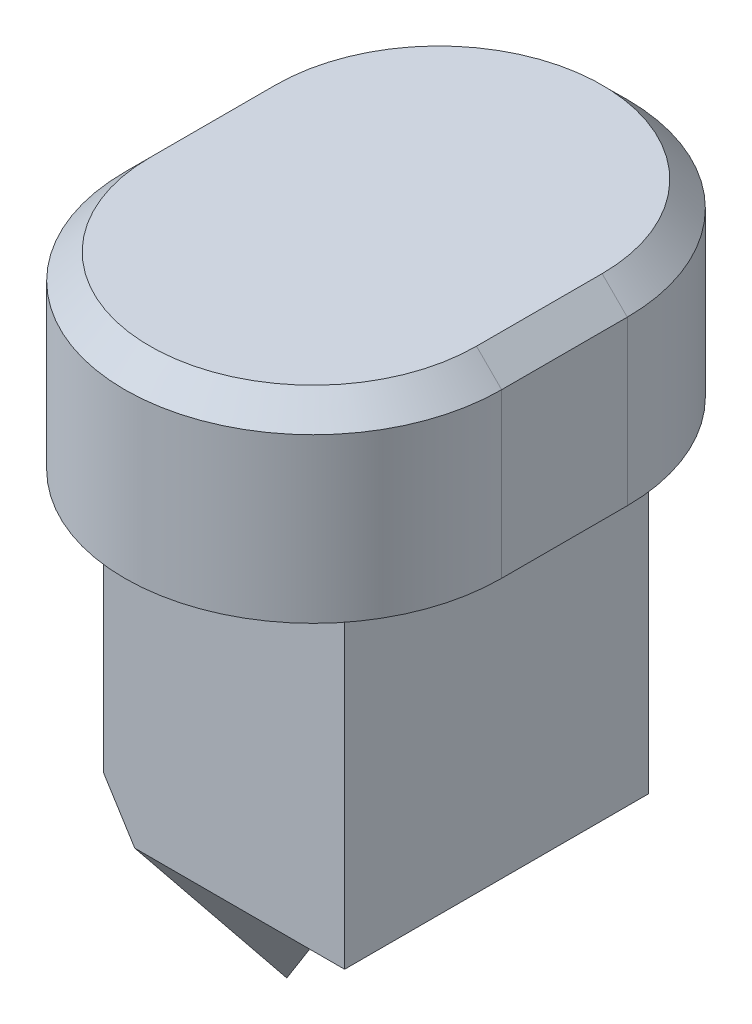
from build123d import *

# Parameters (mm, degrees)
SKETCH1_W               = 19.2
SKETCH1_H               = 24.2
BOSS_EXTRUDE1_DEPTH     = 26.1
BOSS_EXTRUDE2_DEPTH     = 15
BOSS_EXTRUDE3_DEPTH     = 5
BOSS_EXTRUDE4_DEPTH     = 1.5
CHAMFER1_SIZE           = 2.5
FILLET1_R               = 3
SKETCH9_W               = 19.8
SKETCH9_H               = 24.8
SKETCH9_W_2             = 19.2
SKETCH9_H_2             = 24.2
CUT_EXTRUDE_THIN1_DEPTH = 10
SKETCH10_W              = 24.8
SKETCH10_H              = 0.3
CUT_EXTRUDE1_DEPTH      = 19.2
SKETCH12_W              = 19.8
SKETCH12_H              = 24.8
CUT_EXTRUDE3_DEPTH      = 0.3
CHAMFER2_SIZE           = 0.75
CHAMFER3_SIZE           = 0.75
SKETCH14_R              = 2.2
SKETCH14_R_2            = 1.25
CUT_EXTRUDE4_DEPTH      = 4
CHAMFER6_SIZE           = 2
SKETCH16_R              = 1.25
CUT_EXTRUDE6_DEPTH      = 1


with BuildPart() as part:
    # Sketch1 → Boss-Extrude1 (new body)
    with BuildSketch(Plane(origin=(0, 0, 0), x_dir=(1, 0, 0), z_dir=(0, 1, 0))):
        Rectangle(SKETCH1_W, SKETCH1_H)
    extrude(amount=BOSS_EXTRUDE1_DEPTH)

    # Sketch2 → Boss-Extrude2 (add)
    with BuildSketch(Plane(origin=(0, 26.1, 0), x_dir=(1, 0, 0), z_dir=(0, 1, 0))):
        with BuildLine():
            Line((15, 5), (15, -5))
            ThreePointArc((15, -5), (0, -20), (-15, -5))
            Line((-15, -5), (-15, 5))
            ThreePointArc((-15, 5), (0, 20), (15, 5))
        make_face()
    extrude(amount=BOSS_EXTRUDE2_DEPTH)

    # Sketch4 → Boss-Extrude3 (add)
    with BuildSketch(Plane.ZY.offset(9.6)):
        Polygon((-12.1, 0), (0, -15), (12.1, 0), align=None)
    extrude(amount=-BOSS_EXTRUDE3_DEPTH)

    # Sketch6 → Boss-Extrude4 (add, symmetric)
    with BuildSketch(Plane.XY):
        Polygon((-4.6, -5), (9.6, 0), (-4.6, 0), align=None)
    extrude(amount=BOSS_EXTRUDE4_DEPTH, both=True)

    # Chamfer1
    chamfer1_edges = [part.edges().sort_by_distance(p)[0] for p in [
        (-9.6, -7.5, -6.05),
        (-4.6, -7.5, -6.05),
        (-9.6, -7.5, 6.05),
        (-4.6, -7.5, 6.05),
    ]]
    chamfer(chamfer1_edges, length=CHAMFER1_SIZE - 0.0001)  # a hair under: the kernel refuses the full size

    # Fillet1
    fillet1_edges = [part.edges().sort_by_distance(p)[0] for p in [
        (-4.6, 0, -5.194064205),
        (-4.6, 0, 5.194064205),
    ]]
    fillet(fillet1_edges, radius=FILLET1_R)

    # Sketch9 → Cut-Extrude-Thin1 (cut)
    with BuildSketch(Plane.XZ.offset(-26.1)):
        Rectangle(SKETCH9_W, SKETCH9_H)
        Rectangle(SKETCH9_W_2, SKETCH9_H_2, mode=Mode.SUBTRACT)
    extrude(amount=-CUT_EXTRUDE_THIN1_DEPTH, mode=Mode.SUBTRACT)

    # Sketch10 → Cut-Extrude1 (cut)
    with BuildSketch(Plane.ZY.offset(9.6)):
        with Locations((0, 36.25)):
            Rectangle(SKETCH10_W, SKETCH10_H)
    extrude(amount=-CUT_EXTRUDE1_DEPTH, mode=Mode.SUBTRACT)


with BuildPart() as cut_extrude1_piece_1:
    # of the separate pieces the step leaves, piece 1, a body of its own (cut_extrude1_pieces)
    add(part.part.solids().sort_by_distance((-1.6, 0, 1.5))[0])

    # Chamfer3
    chamfer3_edges = [cut_extrude1_piece_1.edges().sort_by_distance(p)[0] for p in [
        (0, 36.1, -12.1),
        (9.6, 36.1, 0),
        (0, 36.1, 12.1),
        (-9.6, 36.1, 0),
    ]]
    chamfer(chamfer3_edges, length=CHAMFER3_SIZE)


with BuildPart() as cut_extrude1_piece_2:
    # of the separate pieces the step leaves, piece 2, a body of its own (cut_extrude1_pieces)
    add(part.part.solids().sort_by_distance((9.9, 36.1, 12.4))[0])

    # Sketch12 → Cut-Extrude3 (cut)
    with BuildSketch(Plane.XZ.offset(-36.1)):
        Rectangle(SKETCH12_W, SKETCH12_H)
    extrude(amount=-CUT_EXTRUDE3_DEPTH, mode=Mode.SUBTRACT)

    # Chamfer2
    chamfer2_edges = [cut_extrude1_piece_2.edges().sort_by_distance(p)[0] for p in [
        (9.9, 26.1, 0),
        (0, 26.1, -12.4),
        (-9.9, 26.1, 0),
        (0, 26.1, 12.4),
    ]]
    chamfer(chamfer2_edges, length=CHAMFER2_SIZE)

    # Sketch14 → Cut-Extrude4 (cut)
    # profile 1 of 2: a face of its own
    with BuildSketch(Plane.XZ.offset(-26.1)):
        with Locations(Location((0, -16.2, 0), (0, 0, 270))):
            Circle(SKETCH14_R)
        with Locations(Location((0, -16.2, 0), (0, 0, 270))):
            Circle(SKETCH14_R_2, mode=Mode.SUBTRACT)
    # profile 2 of 2: a face of its own
    with BuildSketch(Plane.XZ.offset(-26.1)):
        with Locations(Location((0, 16.2, 0), (0, 0, 270))):
            Circle(SKETCH14_R)
        with Locations(Location((0, 16.2, 0), (0, 0, 270))):
            Circle(SKETCH14_R_2, mode=Mode.SUBTRACT)
    extrude(amount=-CUT_EXTRUDE4_DEPTH, mode=Mode.SUBTRACT)

    # Chamfer6
    chamfer6_edges = [cut_extrude1_piece_2.edges().sort_by_distance(p)[0] for p in [
        (0, 41.1, -20),
        (-15, 41.1, 0),
        (0, 41.1, 20),
        (15, 41.1, 0),
    ]]
    chamfer(chamfer6_edges, length=CHAMFER6_SIZE)

    # Sketch16 → Cut-Extrude6 (cut)
    with BuildSketch(Plane.XZ.offset(-26.1)):
        with Locations(Location((0, 16.2, 0), (0, 0, 270))):
            Circle(SKETCH16_R)
        with Locations(Location((0, -16.2, 0), (0, 0, 270))):
            Circle(SKETCH16_R)
    extrude(amount=-CUT_EXTRUDE6_DEPTH, mode=Mode.SUBTRACT)


solid = Compound([cut_extrude1_piece_1.part, cut_extrude1_piece_2.part])
